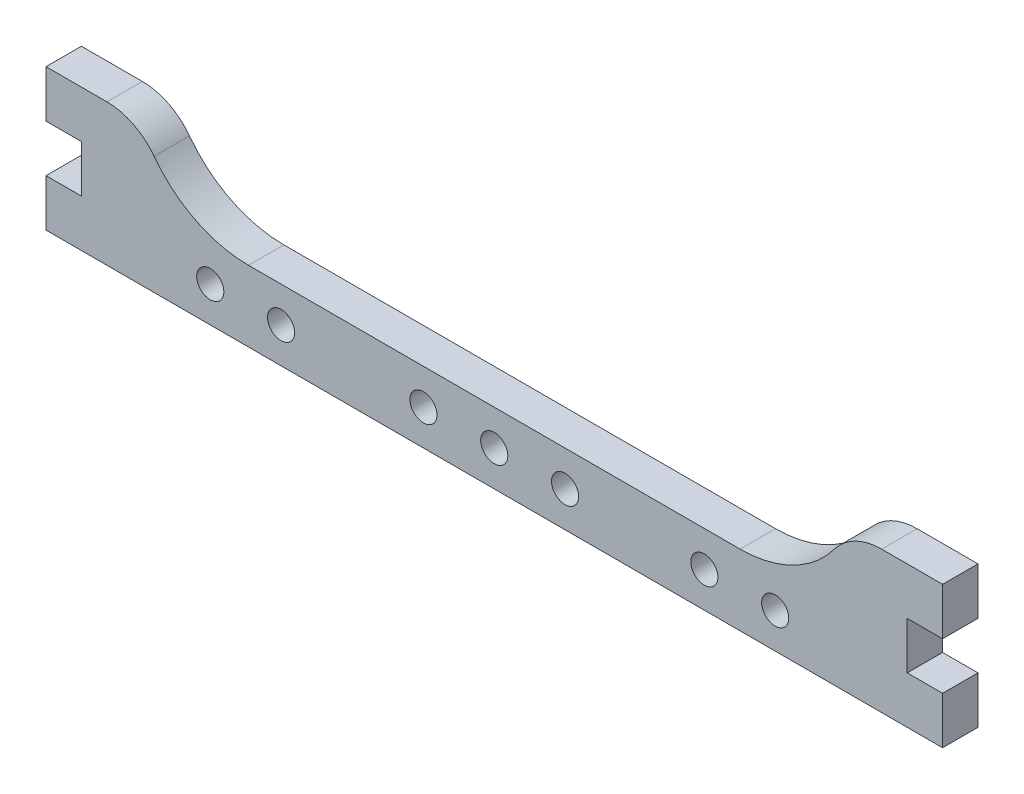
from build123d import *

# Parameters (mm, degrees)
SKETCH1_W           = 70
SKETCH1_H           = 12
BOSS_EXTRUDE1_DEPTH = 1.5
SKETCH2_W           = 60
SKETCH2_H           = 6
CUT_EXTRUDE1_DEPTH  = 38.121422387
FILLET1_R           = 10
FILLET2_R           = 5
SKETCH3_W           = 3
SKETCH3_H           = 4
BOSS_EXTRUDE2_DEPTH = 3
SKETCH5_R           = 1.15
CUT_EXTRUDE4_DEPTH  = 10


with BuildPart() as part:
    # Sketch1 → Boss-Extrude1 (new, symmetric)
    with BuildSketch(Plane.XY):
        with Locations((0, 6)):
            Rectangle(SKETCH1_W, SKETCH1_H)
    extrude(amount=BOSS_EXTRUDE1_DEPTH, both=True)

    # Sketch2 → Cut-Extrude1 (cut, through all)
    with BuildSketch(Plane.XY.offset(1.5)):
        with Locations((0, 9)):
            Rectangle(SKETCH2_W, SKETCH2_H)
    extrude(amount=-CUT_EXTRUDE1_DEPTH, mode=Mode.SUBTRACT)

    # Fillet1
    # the kernel refuses this fillet: 10 mm, written as the material it adds along each edge
    with BuildSketch(Plane(origin=(30, 6, 1.5), x_dir=(-1, 0, 0), z_dir=(0, 0, -1))) as fillet1_piece_1:
        with BuildLine():
            CenterArc((9.16515139, 10), FILLET1_R, 203.578178478, 66.421821522)
            Line((0, 6), (-0.183303028, 5.92))
            ThreePointArc((-0.183303028, 5.92), (-0.2, 3), (-0.2, 0))
            Line((-0.2, 0), (0, -0.2))
            Line((0, -0.2), (9.16515139, -0.2))
            Line((9.16515139, -0.2), (9.16515139, 0))
        make_face()
    extrude(amount=3)
    with BuildSketch(Plane(origin=(-30, 6, 1.5), x_dir=(0, 1, 0), z_dir=(0, 0, -1))) as fillet1_piece_2:
        with BuildLine():
            CenterArc((10, 9.16515139), FILLET1_R, 180, 66.421821522)
            Line((0, 9.16515139), (-0.2, 9.16515139))
            Line((-0.2, 9.16515139), (-0.2, 0))
            Line((-0.2, 0), (0, -0.2))
            ThreePointArc((0, -0.2), (3, -0.2), (5.92, -0.183303028))
            Line((5.92, -0.183303028), (6, 0))
        make_face()
    extrude(amount=3)

    # Fillet2
    fillet2_edges = [part.edges().sort_by_distance(p)[0] for p in [
        (-30, 12, 0),
        (30, 12, 0),
    ]]
    fillet(fillet2_edges, radius=FILLET2_R)

    # Sketch3 → Boss-Extrude2 (add)
    with BuildSketch(Plane.XY.offset(1.5)):
        with Locations((36.5, 10)):
            Rectangle(SKETCH3_W, SKETCH3_H)
        with Locations((36.5, 2)):
            Rectangle(SKETCH3_W, SKETCH3_H)
        with Locations((-36.5, 2)):
            Rectangle(SKETCH3_W, SKETCH3_H)
        with Locations((-36.5, 10)):
            Rectangle(SKETCH3_W, SKETCH3_H)
    extrude(amount=-BOSS_EXTRUDE2_DEPTH)

    # Sketch5 → Cut-Extrude4 (cut)
    with BuildSketch(Plane.XY.offset(1.5)):
        with Locations((-0.005546517, 3)):
            Circle(SKETCH5_R)
        with Locations((-6.007488167, 2.994954434)):
            Circle(SKETCH5_R)
        with Locations((5.998183632, 2.997891531)):
            Circle(SKETCH5_R)
        with Locations((17.806168734, 2.989420739)):
            Circle(SKETCH5_R)
        with Locations((23.809898884, 2.98731227)):
            Circle(SKETCH5_R)
        with Locations((-24.075956243, 2.997909584)):
            Circle(SKETCH5_R)
        with Locations((-18.072226094, 2.995801115)):
            Circle(SKETCH5_R)
    extrude(amount=-CUT_EXTRUDE4_DEPTH, mode=Mode.SUBTRACT)


solid = part.part
